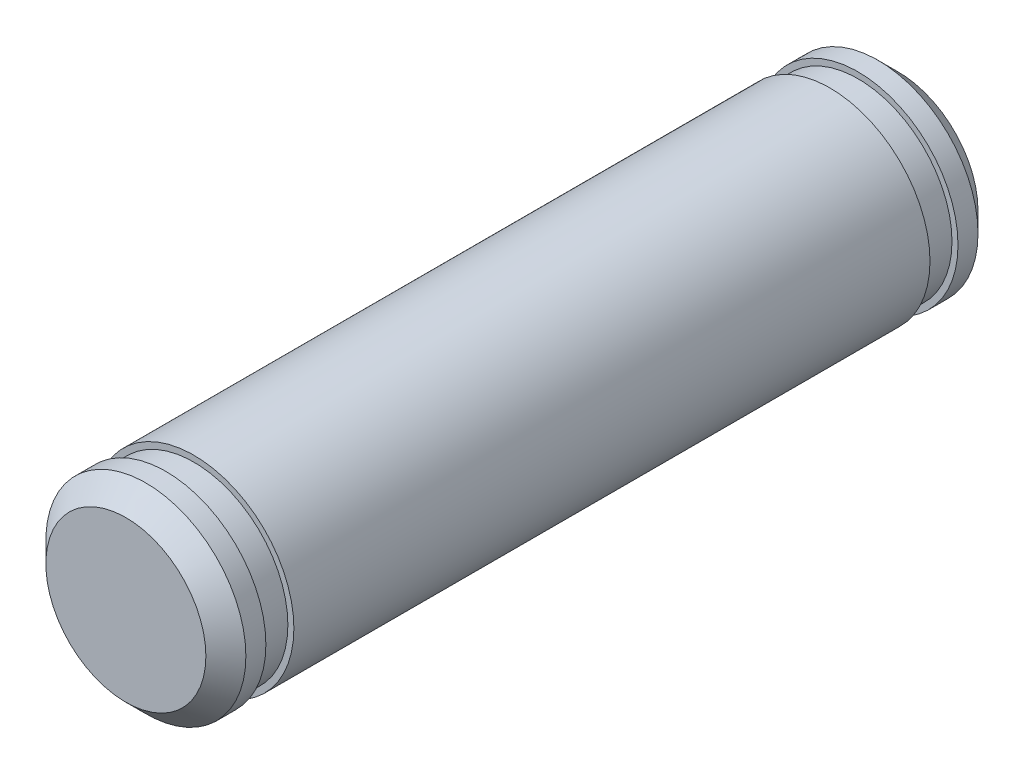
from build123d import *

# Parameters (mm, degrees)
SZKIC1_R                    = 2.5
DODANIE_WYCI_GNI_CIE1_DEPTH = 19.3
WYTNIJ_WYCI_GNI_CIE1_START  = -1.7
SZKIC2_R                    = 2.5
SZKIC2_R_2                  = 2.35
WYTNIJ_WYCI_GNI_CIE1_DEPTH  = 0.7
WYTNIJ_WYCI_GNI_CIE2_START  = -18.3
SZKIC2_2_R                  = 2.5
SZKIC2_2_R_2                = 2.35
WYTNIJ_WYCI_GNI_CIE2_DEPTH  = 0.7
SFAZOWANIE1_SIZE            = 0.5


with BuildPart() as part:
    # Szkic1 → Dodanie-wyciągnięcie1 (new body)
    with BuildSketch(Plane.XY):
        Circle(SZKIC1_R)
    extrude(amount=DODANIE_WYCI_GNI_CIE1_DEPTH)

    # Szkic2 → Wytnij-wyciągnięcie1 (cut)
    with BuildSketch(Plane.XY.offset(19.3).offset(WYTNIJ_WYCI_GNI_CIE1_START)):
        Circle(SZKIC2_R)
        Circle(SZKIC2_R_2, mode=Mode.SUBTRACT)
    extrude(amount=WYTNIJ_WYCI_GNI_CIE1_DEPTH, mode=Mode.SUBTRACT)

    # Szkic2<2> → Wytnij-wyciągnięcie2 (cut)
    with BuildSketch(Plane.XY.offset(19.3).offset(WYTNIJ_WYCI_GNI_CIE2_START)):
        Circle(SZKIC2_2_R)
        Circle(SZKIC2_2_R_2, mode=Mode.SUBTRACT)
    extrude(amount=WYTNIJ_WYCI_GNI_CIE2_DEPTH, mode=Mode.SUBTRACT)

    # Sfazowanie1
    sfazowanie1_edges = [part.edges().sort_by_distance(p)[0] for p in [
        (-2.5, 0, 0),
        (-2.5, 0, 19.3),
    ]]
    chamfer(sfazowanie1_edges, length=SFAZOWANIE1_SIZE)


solid = part.part
